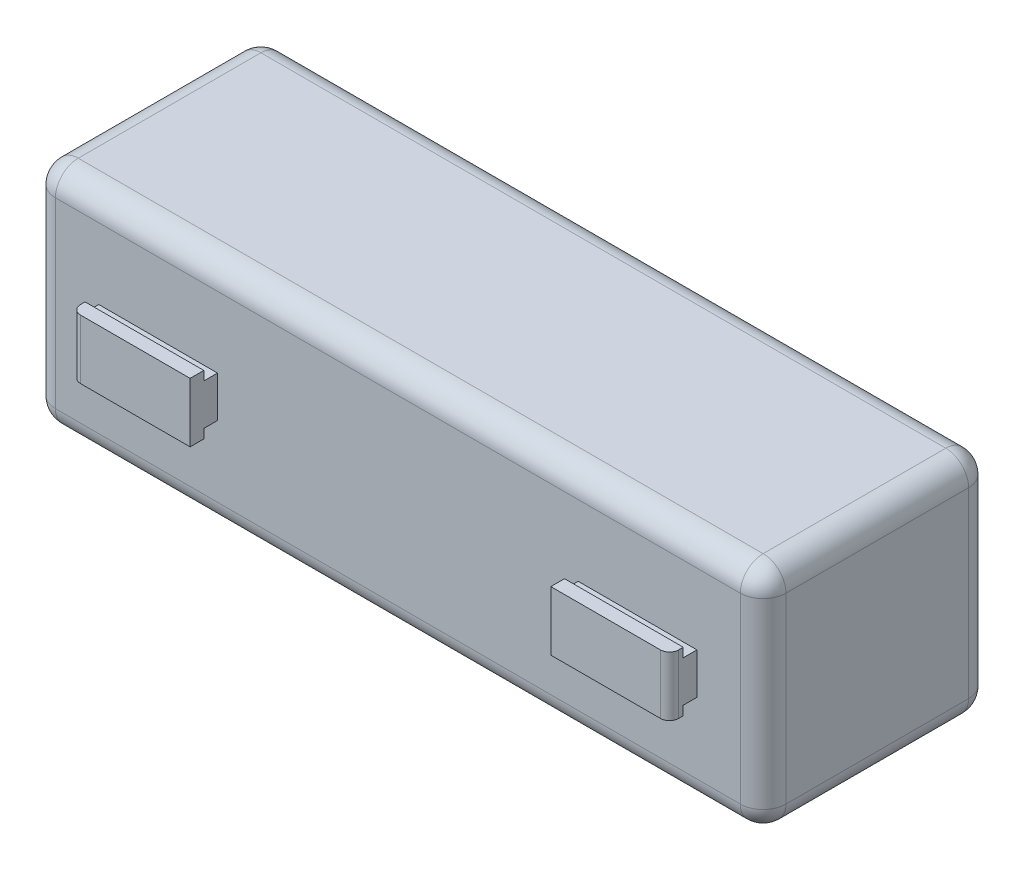
from build123d import *

# Parameters (mm, degrees)
SKETCH1_W                = 160
SKETCH1_H                = 50
BOSS_EXTRUDE1_DEPTH      = 25
SKETCH2_W                = 26
SKETCH2_H                = 13
CONNECTOR_BASE_DEPTH     = 6
SKETCH3_W                = 2
SKETCH3_H                = 3
DOVETAIL_CUT_DEPTH       = 151.851748415
FILLET1_R                = 2
CIRPATTERN1_COUNT        = 4
FILLET1_OF_CIRPATTERN1_R = 2
MIRROR1_START            = -4.5
MIRROR1_DEPTH            = 9
MIRROR1_START_2          = -6.5
MIRROR1_2_DEPTH          = 13
MIRROR1_3_DEPTH          = 9
MIRROR1_4_DEPTH          = 13
FILLET2_R                = 5
SKETCH4_W                = 150
SKETCH4_H                = 40
CUT_EXTRUDE1_DEPTH       = 6


# Read off the part's stored shape, not the designer's step: Mirror1
with BuildPart() as part:
    # Sketch1 → Boss-Extrude1 (new, symmetric)
    with BuildSketch(Plane(origin=(0, 0, 0), x_dir=(1, 0, 0), z_dir=(0, 1, 0))):
        Rectangle(SKETCH1_W, SKETCH1_H)
    extrude(amount=BOSS_EXTRUDE1_DEPTH, both=True)

    # Sketch2 → connector base (add)
    with BuildSketch(Plane(origin=(0, 25, 0), x_dir=(1, 0, 0), z_dir=(0, 1, 0))):
        with Locations((-52.5, 0)):
            Rectangle(SKETCH2_W, SKETCH2_H)
    connector_base = extrude(amount=CONNECTOR_BASE_DEPTH)

    # Sketch3 → dovetail cut (cut, through all)
    with BuildSketch(Plane.ZY.offset(65.5)):
        with Locations((5.5, 26.5)):
            Rectangle(SKETCH3_W, SKETCH3_H)
        with Locations((-5.5, 26.5)):
            Rectangle(SKETCH3_W, SKETCH3_H)
    dovetail_cut = extrude(amount=-DOVETAIL_CUT_DEPTH, mode=Mode.SUBTRACT)

    # Fillet1
    fillet1_edges = [part.edges().sort_by_distance(p)[0] for p in [
        (-65.5, 31, 0),
    ]]
    fillet(fillet1_edges, radius=FILLET1_R)

    # CirPattern1: connector base, dovetail cut ×4 about axis
    cirpattern1_axis = Axis((0, 0, 0), (1, 0, 0))
    add([connector_base.rotate(cirpattern1_axis, i * 360 / CIRPATTERN1_COUNT) for i in range(1, CIRPATTERN1_COUNT)])
    add([dovetail_cut.rotate(cirpattern1_axis, i * 360 / CIRPATTERN1_COUNT) for i in range(1, CIRPATTERN1_COUNT)], mode=Mode.SUBTRACT)

    # Fillet1 of CirPattern1
    fillet1_of_cirpattern1_edges = [part.edges().sort_by_distance(p)[0] for p in [
        (-65.5, 0, 31),
        (-65.5, -31, 0),
        (-65.5, 0, -31),
    ]]
    fillet(fillet1_of_cirpattern1_edges, radius=FILLET1_OF_CIRPATTERN1_R)

    # Mirror1 outline → Mirror1 (add)
    with BuildSketch(Plane.XY.offset(MIRROR1_START)):
        with BuildLine():
            Line((63.5, 31), (39.5, 31))
            Line((39.5, 31), (39.5, 25))
            Line((39.5, 25), (65.5, 25))
            Line((65.5, 25), (65.5, 29))
            ThreePointArc((65.5, 29), (64.914213562, 30.414213562), (63.5, 31))
        make_face()
        with BuildLine():
            Line((65.5, -25), (39.5, -25))
            Line((39.5, -25), (39.5, -31))
            Line((39.5, -31), (63.5, -31))
            ThreePointArc((63.5, -31), (64.914213562, -30.414213562), (65.5, -29))
            Line((65.5, -29), (65.5, -25))
        make_face()
    extrude(amount=MIRROR1_DEPTH)

    # Mirror1 2 outline → Mirror1 2 (add)
    with BuildSketch(Plane.XY.offset(MIRROR1_START_2)):
        with BuildLine():
            Line((63.5, 31), (39.5, 31))
            Line((39.5, 31), (39.5, 28))
            Line((39.5, 28), (65.5, 28))
            Line((65.5, 28), (65.5, 29))
            ThreePointArc((65.5, 29), (64.914213562, 30.414213562), (63.5, 31))
        make_face()
        with BuildLine():
            Line((65.5, -28), (39.5, -28))
            Line((39.5, -28), (39.5, -31))
            Line((39.5, -31), (63.5, -31))
            ThreePointArc((63.5, -31), (64.914213562, -30.414213562), (65.5, -29))
            Line((65.5, -29), (65.5, -28))
        make_face()
    extrude(amount=MIRROR1_2_DEPTH)

    # Mirror1 3 outline → Mirror1 3 (add)
    with BuildSketch(Plane(origin=(0, 0, 0), x_dir=(1, 0, 0), z_dir=(0, 1, 0)).offset(MIRROR1_START)):
        with BuildLine():
            Line((63.5, 31), (39.5, 31))
            Line((39.5, 31), (39.5, 25))
            Line((39.5, 25), (65.5, 25))
            Line((65.5, 25), (65.5, 29))
            ThreePointArc((65.5, 29), (64.914213562, 30.414213562), (63.5, 31))
        make_face()
        with BuildLine():
            Line((65.5, -25), (39.5, -25))
            Line((39.5, -25), (39.5, -31))
            Line((39.5, -31), (63.5, -31))
            ThreePointArc((63.5, -31), (64.914213562, -30.414213562), (65.5, -29))
            Line((65.5, -29), (65.5, -25))
        make_face()
    extrude(amount=MIRROR1_3_DEPTH)

    # Mirror1 4 outline → Mirror1 4 (add)
    with BuildSketch(Plane(origin=(0, 0, 0), x_dir=(1, 0, 0), z_dir=(0, 1, 0)).offset(MIRROR1_START_2)):
        with BuildLine():
            Line((63.5, 31), (39.5, 31))
            Line((39.5, 31), (39.5, 28))
            Line((39.5, 28), (65.5, 28))
            Line((65.5, 28), (65.5, 29))
            ThreePointArc((65.5, 29), (64.914213562, 30.414213562), (63.5, 31))
        make_face()
        with BuildLine():
            Line((65.5, -28), (39.5, -28))
            Line((39.5, -28), (39.5, -31))
            Line((39.5, -31), (63.5, -31))
            ThreePointArc((63.5, -31), (64.914213562, -30.414213562), (65.5, -29))
            Line((65.5, -29), (65.5, -28))
        make_face()
    extrude(amount=MIRROR1_4_DEPTH)

    # Fillet2
    fillet2_edges = [part.edges().sort_by_distance(p)[0] for p in [
        (80, 25, 0),
        (0, 25, -25),
        (-80, 25, 0),
        (0, -25, -25),
        (80, -25, 0),
        (0, -25, 25),
        (-80, -25, 0),
        (-80, 0, -25),
        (80, 0, -25),
        (80, 0, 25),
        (-80, 0, 25),
        (0, 25, 25),
    ]]
    fillet(fillet2_edges, radius=FILLET2_R)

    # Sketch4 → Cut-Extrude1 (cut)
    with BuildSketch(Plane(origin=(0, 31, 0), x_dir=(1, 0, 0), z_dir=(0, 1, 0))):
        Rectangle(SKETCH4_W, SKETCH4_H)
    extrude(amount=-CUT_EXTRUDE1_DEPTH, mode=Mode.SUBTRACT)


with BuildPart() as body_2:
    # Split1: the piece on the far side of the plane
    add(part.part)
    split(bisect_by=Plane(origin=(0, -20, 0), x_dir=(0, 0, -1), z_dir=(0, -1, 0)), keep=Keep.BOTTOM)


with BuildPart() as part_1:
    add(part.part)

    # Split1
    split(bisect_by=Plane(origin=(0, -20, 0), x_dir=(0, 0, -1), z_dir=(0, -1, 0)), keep=Keep.TOP)


solid = Compound([body_2.part, part_1.part])
